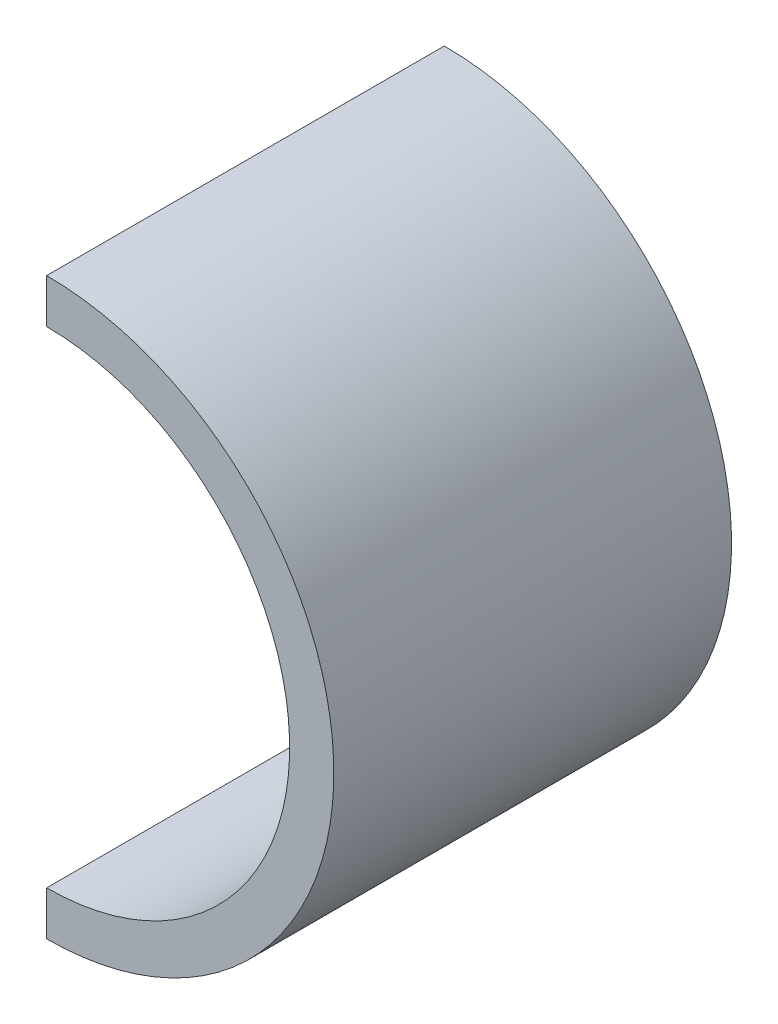
from build123d import *

# Parameters (mm, degrees)
BASE_FLANGE1_DEPTH = 180


# Sheet-metal steps are written as plain solids
with BuildPart() as part:
    # Sketch1 → Base-Flange1 (new body)
    with BuildSketch(Plane.XY):
        with BuildLine():
            ThreePointArc((0, -110), (110, 0), (0, 110))
            Line((0, 110), (0, 130))
            ThreePointArc((0, 130), (130, 0), (0, -130))
            Line((0, -130), (0, -110))
        make_face()
    extrude(amount=BASE_FLANGE1_DEPTH)


solid = part.part
